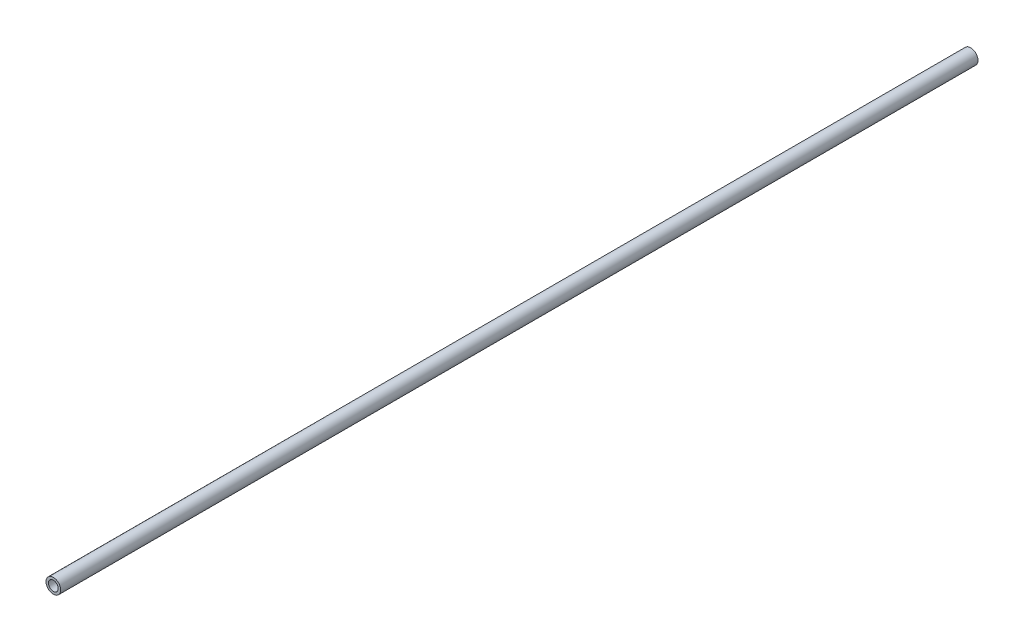
from build123d import *

# Parameters (mm, degrees)
CROQUIS2_R              = 4.8
CROQUIS2_R_2            = 3.2
SALIENTE_EXTRUIR1_DEPTH = 600


with BuildPart() as part:
    # Croquis2 → Saliente-Extruir1 (new body)
    with BuildSketch(Plane(origin=(0, 0, 0), x_dir=(0, 1, 0), z_dir=(0, 0, 1))):
        Circle(CROQUIS2_R)
        Circle(CROQUIS2_R_2, mode=Mode.SUBTRACT)
    extrude(amount=SALIENTE_EXTRUIR1_DEPTH)


solid = part.part
